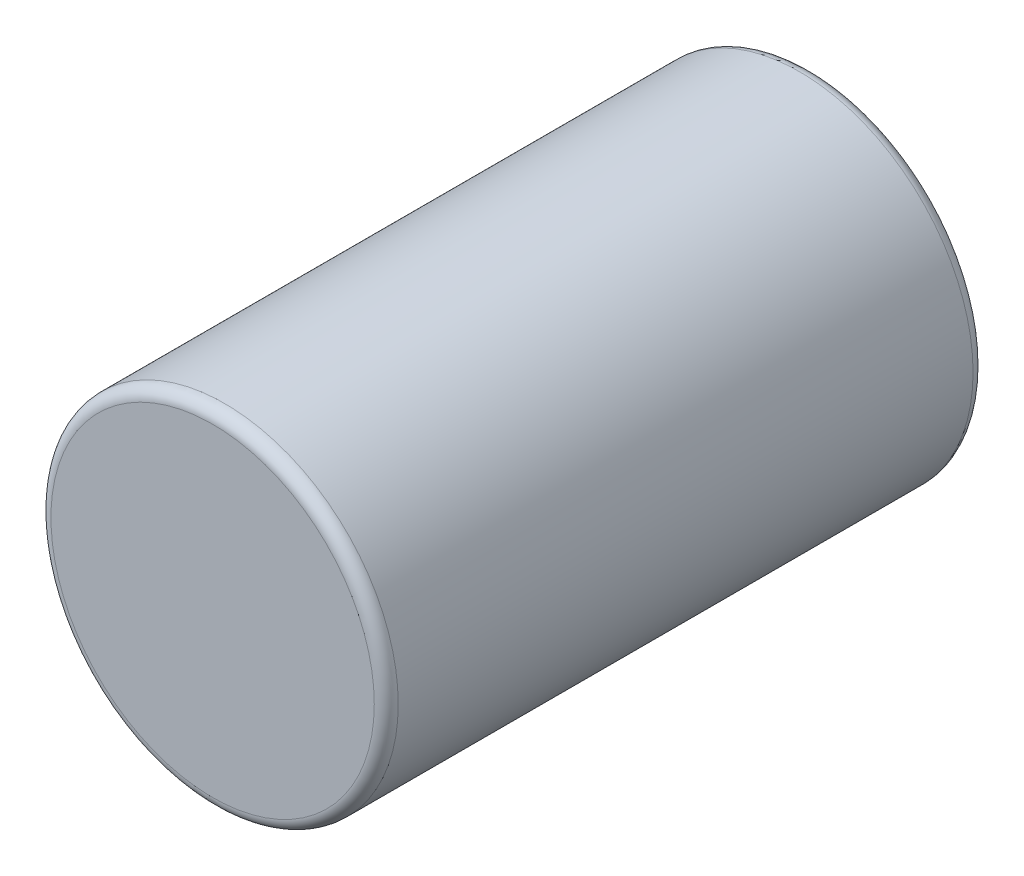
from build123d import *

# Parameters (mm, degrees)
CROQUIS1_R              = 0.725
SALIENTE_EXTRUIR1_DEPTH = 2.5
REDONDEO1_R             = 0.05


with BuildPart() as part:
    # Croquis1 → Saliente-Extruir1 (new body)
    with BuildSketch(Plane.XY):
        Circle(CROQUIS1_R)
    extrude(amount=SALIENTE_EXTRUIR1_DEPTH)

    # Redondeo1
    redondeo1_edges = [part.edges().sort_by_distance(p)[0] for p in [
        (-0.725, 0, 0),
        (-0.725, 0, 2.5),
    ]]
    fillet(redondeo1_edges, radius=REDONDEO1_R)


solid = part.part
